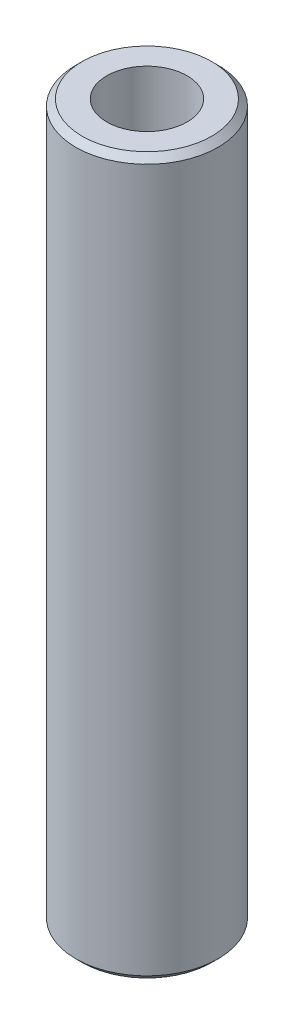
from build123d import *

# Parameters (mm, degrees)
SKETCH1_R           = 37.5
BOSS_EXTRUDE1_DEPTH = 377.227544865
SKETCH2_R           = 21.152646461
CUT_EXTRUDE1_DEPTH  = 381.937160966
CHAMFER1_SIZE       = 3.366939013


with BuildPart() as part:
    # Sketch1 → Boss-Extrude1 (new body)
    with BuildSketch(Plane(origin=(0, 0, 0), x_dir=(1, 0, 0), z_dir=(0, 1, 0))):
        Circle(SKETCH1_R)
    extrude(amount=BOSS_EXTRUDE1_DEPTH)

    # Sketch2 → Cut-Extrude1 (cut, through all)
    with BuildSketch(Plane(origin=(0, 0, 0), x_dir=(1, 0, 0), z_dir=(0, 1, 0))):
        Circle(SKETCH2_R)
    extrude(amount=CUT_EXTRUDE1_DEPTH, mode=Mode.SUBTRACT)

    # Chamfer1
    chamfer1_edges = [part.edges().sort_by_distance(p)[0] for p in [
        (-37.5, 377.227544865, 0),
        (-37.5, 0, 0),
    ]]
    chamfer(chamfer1_edges, length=CHAMFER1_SIZE)


solid = part.part
